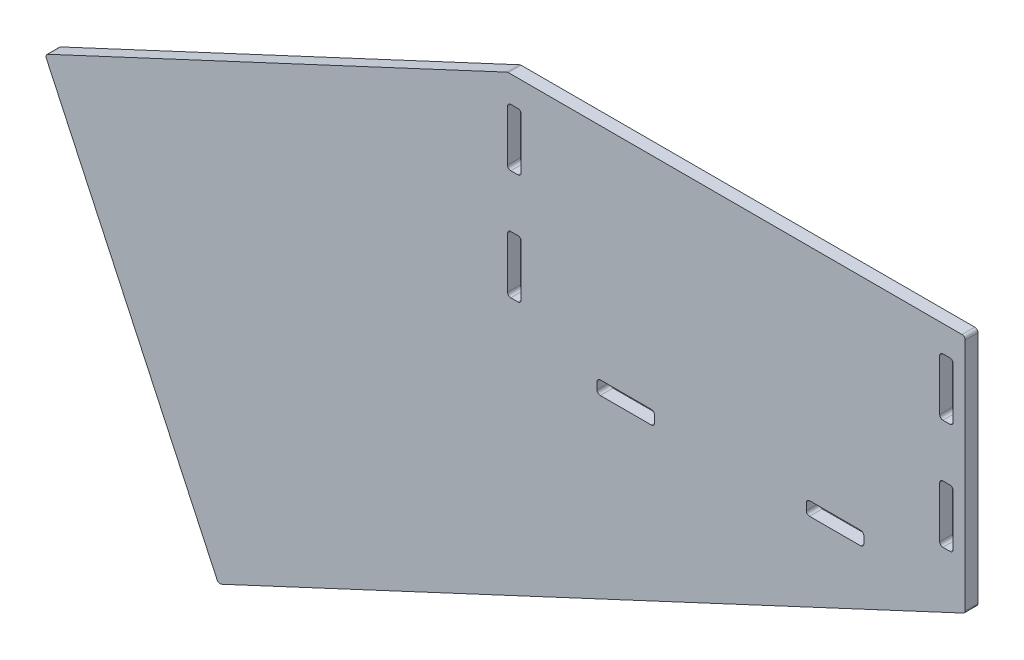
from build123d import *

# Parameters (mm, degrees)
SKETCH1_W           = 416.56
SKETCH1_H           = 219.075
BOSS_EXTRUDE1_DEPTH = 6.35
BOSS_EXTRUDE2_DEPTH = 6.35
FILLET1_R           = 3.175


with BuildPart() as part:
    # Sketch1 → Boss-Extrude1 (new, symmetric)
    with BuildSketch(Plane.XY):
        with Locations((0, -109.5375)):
            Rectangle(SKETCH1_W, SKETCH1_H)
    extrude(amount=BOSS_EXTRUDE1_DEPTH, both=True)

    # Sketch2 → Boss-Extrude2 (add, symmetric)
    with BuildSketch(Plane.XY):
        Polygon((-221.742, 0), (-682.146355815, -214.690076964), (-509.434106267, -585.072691377), (233.68, -238.552892741), (233.68, 0), (208.28, 0), (208.28, -26.19375), (221.742, -26.19375), (221.742, -83.34375), (208.28, -83.34375), (208.28, -135.73125), (221.742, -135.73125), (221.742, -192.88125), (208.28, -192.88125), (208.28, -219.075), (132.715, -219.075), (132.715, -232.537), (75.565, -232.537), (75.565, -219.075), (-75.565, -219.075), (-75.565, -232.537), (-132.715, -232.537), (-132.715, -219.075), (-208.28, -219.075), (-208.28, -192.88125), (-221.742, -192.88125), (-221.742, -135.73125), (-208.28, -135.73125), (-208.28, -83.34375), (-221.742, -83.34375), (-221.742, -26.19375), (-208.28, -26.19375), (-208.28, 0), align=None)
    extrude(amount=BOSS_EXTRUDE2_DEPTH, both=True)

    # Fillet1
    fillet1_edges = [part.edges().sort_by_distance(p)[0] for p in [
        (75.565, -232.537, 0),
        (75.565, -219.075, 0),
        (132.715, -232.537, 0),
        (132.715, -219.075, 0),
        (-132.715, -232.537, 0),
        (-132.715, -219.075, 0),
        (-75.565, -232.537, 0),
        (-75.565, -219.075, 0),
        (-221.742, -192.88125, 0),
        (-221.742, -135.73125, 0),
        (-208.28, -135.73125, 0),
        (-208.28, -192.88125, 0),
        (-208.28, -83.34375, 0),
        (-221.742, -83.34375, 0),
        (-208.28, -26.19375, 0),
        (-221.742, -26.19375, 0),
        (208.28, -135.73125, 0),
        (221.742, -135.73125, 0),
        (208.28, -192.88125, 0),
        (221.742, -192.88125, 0),
        (221.742, -83.34375, 0),
        (208.28, -83.34375, 0),
        (221.742, -26.19375, 0),
        (208.28, -26.19375, 0),
        (233.68, -238.552892741, 0),
        (233.68, 0, 0),
        (-221.742, 0, 0),
        (-509.434106267, -585.072691377, 0),
        (-682.146355815, -214.690076964, 0),
    ]]
    fillet(fillet1_edges, radius=FILLET1_R)


solid = part.part
